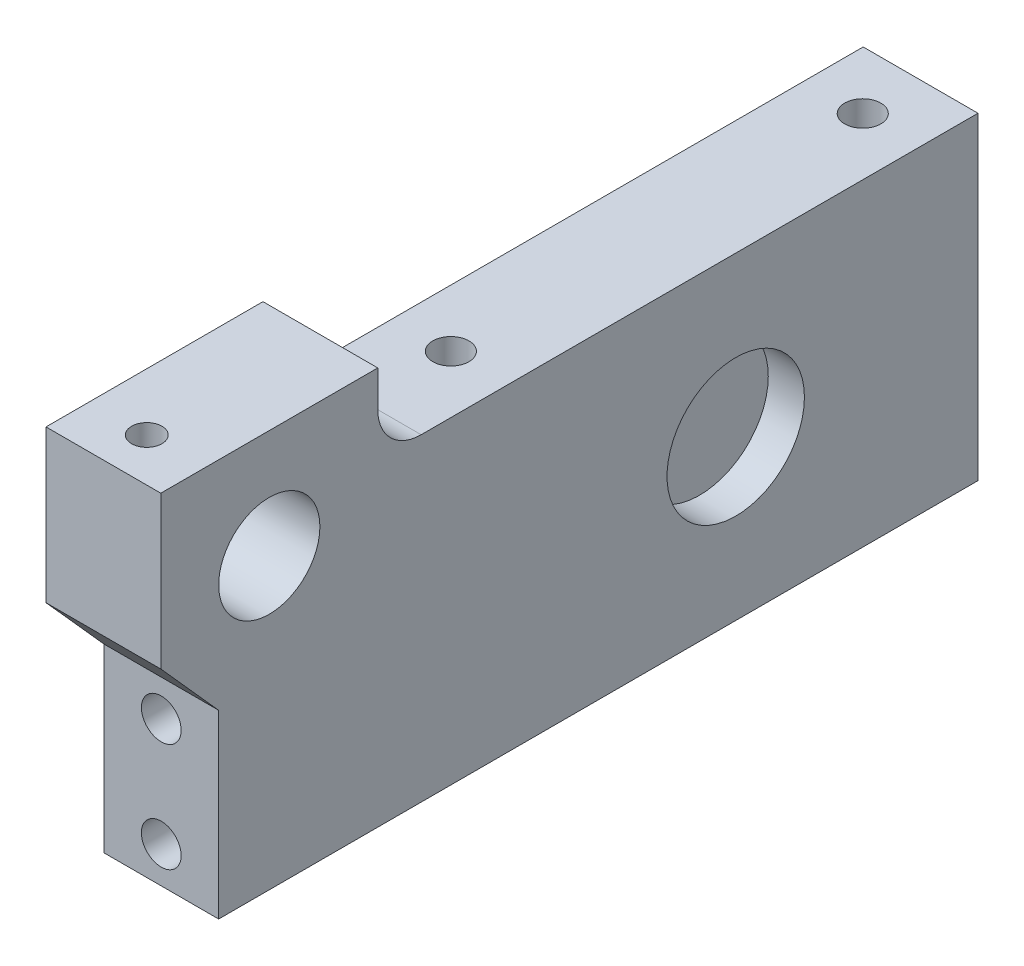
from build123d import *

# Parameters (mm, degrees)
ESBO_O1_R                                            = 7
RESSALTO_EXTRUS_O1_DEPTH                             = 7.9375
ESCAREADO_PARA_PARAFUSO_DE_M_QUINA_COM_C_D           = 5.5
ESCAREADO_PARA_PARAFUSO_DE_M_QUINA_COM_C_DEPTH       = 30
ESCAREADO_PARA_PARAFUSO_DE_M_QUINA_COM_C_CSINK_D     = 10.4
ESCAREADO_PARA_PARAFUSO_DE_M_QUINA_COM_C_CSINK_ANGLE = 90
ESCAREADO_PARA_PARAFUSO_DE_M_QUINA_COM_C_TIP         = 1.652366702
ESCAREADO_PARA_PARAFUSO_DE_M_QUINA_C_2_D             = 6.6
ESCAREADO_PARA_PARAFUSO_DE_M_QUINA_C_2_DEPTH         = 30
ESCAREADO_PARA_PARAFUSO_DE_M_QUINA_C_2_CSINK_D       = 12.6
ESCAREADO_PARA_PARAFUSO_DE_M_QUINA_C_2_CSINK_ANGLE   = 90
ESCAREADO_PARA_PARAFUSO_DE_M_QUINA_C_2_TIP           = 1.982840043
BROCA_DE_ROSQUEAR_PARA_TARRAXA_DE_M5X0_8_D           = 4.2
BROCA_DE_ROSQUEAR_PARA_TARRAXA_DE_M5X0_8_DEPTH       = 20
BROCA_DE_ROSQUEAR_PARA_TARRAXA_DE_M5X0_8_TIP         = 1.2618073
BROCA_DE_ROSQUEAR_PARA_TARRAXA_DE_M5_2_D             = 4.2
BROCA_DE_ROSQUEAR_PARA_TARRAXA_DE_M5_2_DEPTH         = 20
BROCA_DE_ROSQUEAR_PARA_TARRAXA_DE_M5_2_TIP           = 1.2618073
BROCA_DE_ROSQUEAR_PARA_TARRAXA_DE_M6X1_0_D           = 5
BROCA_DE_ROSQUEAR_PARA_TARRAXA_DE_M6X1_0_DEPTH       = 15
BROCA_DE_ROSQUEAR_PARA_TARRAXA_DE_M6X1_0_TIP         = 1.502151548
FILLET1_R                                            = 6
SKETCH7_R                                            = 9.5
CUT_EXTRUDE4_DEPTH                                   = 5


with BuildPart() as part:
    # Esboço1 → Ressalto-extrusão1 (new, symmetric)
    with BuildSketch(Plane(origin=(0, 0, 0), x_dir=(0, 0, -1), z_dir=(1, 0, 0))):
        Polygon((-10, 38.5), (-40, 38.5), (-40, 23.5), (-40, 17.44427191), (-32, 8.5), (-32, -16.5), (73, -16.5), (73, 27.5), (-10, 27.5), align=None)
        with Locations((-25, 23.5)):
            Circle(ESBO_O1_R, mode=Mode.SUBTRACT)
    extrude(amount=RESSALTO_EXTRUS_O1_DEPTH, both=True)

    # Escareado para parafuso de m_quina com c
    with Locations(Plane(origin=(33.0625, -10.251665499, 40.070399895), x_dir=(1, 0, 0), z_dir=(0, 0, 1))):
        with Locations((-33.0625, 13.751665499), (-33.0625, -1.248334501), (33.0625, -1.248334501), (33.0625, 13.751665499)):
            CounterSinkHole(ESCAREADO_PARA_PARAFUSO_DE_M_QUINA_COM_C_D / 2, ESCAREADO_PARA_PARAFUSO_DE_M_QUINA_COM_C_CSINK_D / 2, depth=ESCAREADO_PARA_PARAFUSO_DE_M_QUINA_COM_C_DEPTH, counter_sink_angle=ESCAREADO_PARA_PARAFUSO_DE_M_QUINA_COM_C_CSINK_ANGLE)
            with Locations((0, 0, -(ESCAREADO_PARA_PARAFUSO_DE_M_QUINA_COM_C_DEPTH + ESCAREADO_PARA_PARAFUSO_DE_M_QUINA_COM_C_TIP / 2))):  # 118° drill point
                Cone(0, ESCAREADO_PARA_PARAFUSO_DE_M_QUINA_COM_C_D / 2, ESCAREADO_PARA_PARAFUSO_DE_M_QUINA_COM_C_TIP, mode=Mode.SUBTRACT)

    # Escareado para parafuso de m_quina c 2
    with Locations(Plane(origin=(33.0625, -23.5, -11.460196829), x_dir=(-1, 0, 0), z_dir=(0, -1, 0))):
        with Locations((33.06, 53.539803171), (33.06, -3.413475694), (-33.06, -3.413475694), (-33.06, 49.586524306)):
            CounterSinkHole(ESCAREADO_PARA_PARAFUSO_DE_M_QUINA_C_2_D / 2, ESCAREADO_PARA_PARAFUSO_DE_M_QUINA_C_2_CSINK_D / 2, depth=ESCAREADO_PARA_PARAFUSO_DE_M_QUINA_C_2_DEPTH, counter_sink_angle=ESCAREADO_PARA_PARAFUSO_DE_M_QUINA_C_2_CSINK_ANGLE)
            with Locations((0, 0, -(ESCAREADO_PARA_PARAFUSO_DE_M_QUINA_C_2_DEPTH + ESCAREADO_PARA_PARAFUSO_DE_M_QUINA_C_2_TIP / 2))):  # 118° drill point
                Cone(0, ESCAREADO_PARA_PARAFUSO_DE_M_QUINA_C_2_D / 2, ESCAREADO_PARA_PARAFUSO_DE_M_QUINA_C_2_TIP, mode=Mode.SUBTRACT)

    # Broca de rosquear para tarraxa de M5x0.8
    with Locations(Plane(origin=(33.0625, 48.5, -11.460196829), x_dir=(1, 0, 0), z_dir=(0, 1, 0))):
        with Locations((33.06, -45.460196829), (-33.065, -45.460196829)):
            Hole(BROCA_DE_ROSQUEAR_PARA_TARRAXA_DE_M5X0_8_D / 2, depth=BROCA_DE_ROSQUEAR_PARA_TARRAXA_DE_M5X0_8_DEPTH)
            with Locations((0, 0, -(BROCA_DE_ROSQUEAR_PARA_TARRAXA_DE_M5X0_8_DEPTH + BROCA_DE_ROSQUEAR_PARA_TARRAXA_DE_M5X0_8_TIP / 2))):  # 118° drill point
                Cone(0, BROCA_DE_ROSQUEAR_PARA_TARRAXA_DE_M5X0_8_D / 2, BROCA_DE_ROSQUEAR_PARA_TARRAXA_DE_M5X0_8_TIP, mode=Mode.SUBTRACT)

    # Broca de rosquear para tarraxa de M5 2
    with Locations(Plane(origin=(33.0625, -10.251665499, 0), x_dir=(-1, 0, 0), z_dir=(0, 0, -1))):
        with Locations((-33.06, 43.751665499), (33.065, 43.751665499)):
            Hole(BROCA_DE_ROSQUEAR_PARA_TARRAXA_DE_M5_2_D / 2, depth=BROCA_DE_ROSQUEAR_PARA_TARRAXA_DE_M5_2_DEPTH)
            with Locations((0, 0, -(BROCA_DE_ROSQUEAR_PARA_TARRAXA_DE_M5_2_DEPTH + BROCA_DE_ROSQUEAR_PARA_TARRAXA_DE_M5_2_TIP / 2))):  # 118° drill point
                Cone(0, BROCA_DE_ROSQUEAR_PARA_TARRAXA_DE_M5_2_D / 2, BROCA_DE_ROSQUEAR_PARA_TARRAXA_DE_M5_2_TIP, mode=Mode.SUBTRACT)

    # Broca de rosquear para tarraxa de M6x1.01
    with Locations(Plane(origin=(33.0625, 27.5, -11.460196829), x_dir=(1, 0, 0), z_dir=(0, 1, 0))):
        with Locations((33.06, 49.539803171), (-33.06, 53.539803171), (-33.06, -3.413475694), (33.06, -3.413475694)):
            Hole(BROCA_DE_ROSQUEAR_PARA_TARRAXA_DE_M6X1_0_D / 2, depth=BROCA_DE_ROSQUEAR_PARA_TARRAXA_DE_M6X1_0_DEPTH)
            with Locations((0, 0, -(BROCA_DE_ROSQUEAR_PARA_TARRAXA_DE_M6X1_0_DEPTH + BROCA_DE_ROSQUEAR_PARA_TARRAXA_DE_M6X1_0_TIP / 2))):  # 118° drill point
                Cone(0, BROCA_DE_ROSQUEAR_PARA_TARRAXA_DE_M6X1_0_D / 2, BROCA_DE_ROSQUEAR_PARA_TARRAXA_DE_M6X1_0_TIP, mode=Mode.SUBTRACT)

    # Fillet1
    # the kernel refuses this fillet: 6 mm, written as the material it adds along each edge
    with BuildSketch(Plane(origin=(7.9375, 27.5, 10), x_dir=(0, 1, 0), z_dir=(-1, 0, 0))) as fillet1_piece_1_section:
        with BuildLine():
            CenterArc((FILLET1_R, FILLET1_R), FILLET1_R, 180, 90)
            Line((0, FILLET1_R), (0, 0))
            Line((0, 0), (FILLET1_R, 0))
        make_face()
    fillet1_piece_1 = extrude(amount=15.875, mode=Mode.PRIVATE)
    fillet1_piece_1 = fillet1_piece_1 - Plane(origin=(-0.0025, 33.5, 8.627789353), x_dir=(1, 0, 0), z_dir=(0, 0, 1)) * Cylinder(2.1, 56, mode=Mode.PRIVATE)
    add(fillet1_piece_1)

    # Sketch7 → Cut-Extrude4 (cut)
    with BuildSketch(Plane(origin=(7.9375, 0, 0), x_dir=(0, 0, -1), z_dir=(1, 0, 0))):
        with Locations((39.5, 5.5)):
            Circle(SKETCH7_R)
    extrude(amount=-CUT_EXTRUDE4_DEPTH, mode=Mode.SUBTRACT)


solid = part.part
